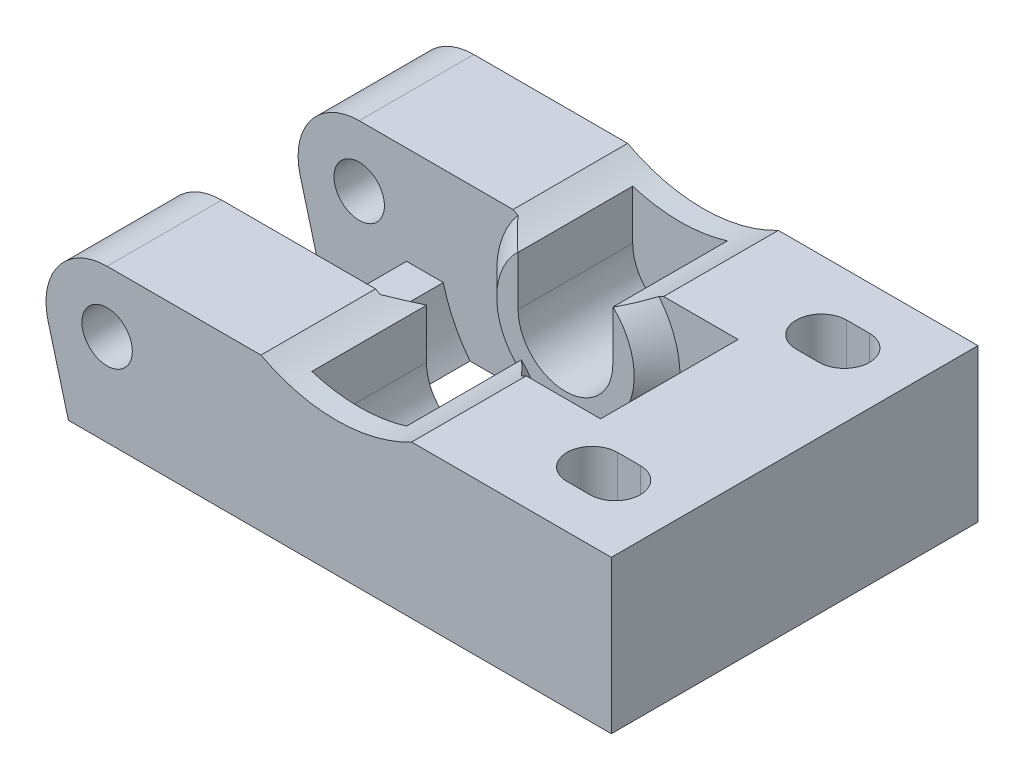
from build123d import *

# Parameters (mm, degrees)
SKETCH1_R               = 1.65
BOSS_EXTRUDE1_DEPTH     = 24
CUT_EXTRUDE1_DEPTH      = 4.5
CUT_EXTRUDE1_DEPTH_BACK = 4.5
CUT_EXTRUDE3_DEPTH      = 10.5
CUT_EXTRUDE3_DEPTH_BACK = 10.5
CUT_EXTRUDE2_DEPTH      = 33.202484376
BOSS_EXTRUDE2_DEPTH     = 1.5
BOSS_EXTRUDE3_START     = 1.5
BOSS_EXTRUDE3_DEPTH     = 1.5
CHAMFER1_SIZE           = 1.5
SKETCH7_R               = 10.5
CUT_EXTRUDE4_DEPTH      = 32.192947921


with BuildPart() as part:
    # Sketch1 → Boss-Extrude1 (new body)
    with BuildSketch(Plane.XY):
        with BuildLine():
            Line((-18.863703305, -1.03527618), (-17.533409567, -6))
            Line((-17.533409567, -6), (18, -6))
            Line((18, -6), (18, 4))
            Line((18, 4), (-15, 4))
            ThreePointArc((-15, 4), (-18.173413361, 2.435045716), (-18.863703305, -1.03527618))
        make_face()
        with Locations((-15, 0)):
            Circle(SKETCH1_R, mode=Mode.SUBTRACT)
    extrude(amount=BOSS_EXTRUDE1_DEPTH)

    # Sketch2 → Cut-Extrude1 (cut, two sides: drawn at the far end of the back side and taken through both)
    with BuildSketch(Plane.XY.offset(12).offset(-CUT_EXTRUDE1_DEPTH_BACK)):
        with BuildLine():
            Line((-11.901189968, -2.421210935), (-19.809111658, -31.933976465))
            Line((-19.809111658, -31.933976465), (-19.809111658, 9.8))
            Line((-19.809111658, 9.8), (9.8, 9.8))
            Line((9.8, 9.8), (9.8, 0))
            ThreePointArc((9.8, 0), (1.220098284, -9.723752371), (-9.496195955, -2.421210935))
            Line((-9.496195955, -2.421210935), (-11.901189968, -2.421210935))
        make_face()
    extrude(amount=CUT_EXTRUDE1_DEPTH + CUT_EXTRUDE1_DEPTH_BACK, mode=Mode.SUBTRACT)

    # Sketch4 → Cut-Extrude3 (cut, two sides: drawn at the far end of the back side and taken through both)
    with BuildSketch(Plane.XY.offset(12).offset(-CUT_EXTRUDE3_DEPTH_BACK)):
        with BuildLine():
            Line((-3.1, 0), (-3.1, 6.453034263))
            Line((-3.1, 6.453034263), (3.1, 6.453034263))
            Line((3.1, 6.453034263), (3.1, 0))
            ThreePointArc((3.1, 0), (0, -3.1), (-3.1, 0))
        make_face()
    extrude(amount=CUT_EXTRUDE3_DEPTH + CUT_EXTRUDE3_DEPTH_BACK, mode=Mode.SUBTRACT)

    # Sketch3 → Cut-Extrude2 (cut, through all)
    with BuildSketch(Plane.XZ.offset(6)):
        with BuildLine():
            Line((13.75, 17.85), (12.25, 17.85))
            ThreePointArc((12.25, 17.85), (10.6, 19.5), (12.25, 21.15))
            Line((12.25, 21.15), (13.75, 21.15))
            ThreePointArc((13.75, 21.15), (15.4, 19.5), (13.75, 17.85))
        make_face()
        with BuildLine():
            Line((13.75, 6.15), (12.25, 6.15))
            ThreePointArc((12.25, 6.15), (10.6, 4.5), (12.25, 2.85))
            Line((12.25, 2.85), (13.75, 2.85))
            ThreePointArc((13.75, 2.85), (15.4, 4.5), (13.75, 6.15))
        make_face()
    extrude(amount=-CUT_EXTRUDE2_DEPTH, mode=Mode.SUBTRACT)

    # Sketch5 → Boss-Extrude2 (add)
    with BuildSketch(Plane.XY.offset(7.5)):
        with BuildLine():
            Line((-3.1, 0), (-3.1, 3.261901286))
            ThreePointArc((-3.1, 3.261901286), (0, -4.5), (3.1, 3.261901286))
            Line((3.1, 3.261901286), (3.1, 0))
            ThreePointArc((3.1, 0), (0, -3.1), (-3.1, 0))
        make_face()
    extrude(amount=BOSS_EXTRUDE2_DEPTH)

    # Sketch6 → Boss-Extrude3 (add)
    with BuildSketch(Plane(origin=(0, 0, 16.5), x_dir=(-1, 0, 0), z_dir=(0, 0, -1)).offset(BOSS_EXTRUDE3_START)):
        with BuildLine():
            Line((-3.1, 0), (-3.1, 3.261901286))
            ThreePointArc((-3.1, 3.261901286), (0, -4.5), (3.1, 3.261901286))
            Line((3.1, 3.261901286), (3.1, 0))
            ThreePointArc((3.1, 0), (0, -3.1), (-3.1, 0))
        make_face()
    extrude(amount=-BOSS_EXTRUDE3_DEPTH)

    # Chamfer1
    chamfer1_edges = [part.edges().sort_by_distance(p)[0] for p in [
        (0, -4.5, 7.5),
        (0, -4.5, 16.5),
    ]]
    chamfer(chamfer1_edges, length=CHAMFER1_SIZE - 0.0001)  # a hair under: the kernel refuses the full size

    # Sketch7 → Cut-Extrude4 (cut, through all)
    with BuildSketch(Plane.XY.offset(24)):
        with Locations((0, 13.27)):
            Circle(SKETCH7_R)
    extrude(amount=-CUT_EXTRUDE4_DEPTH, mode=Mode.SUBTRACT)


solid = part.part
